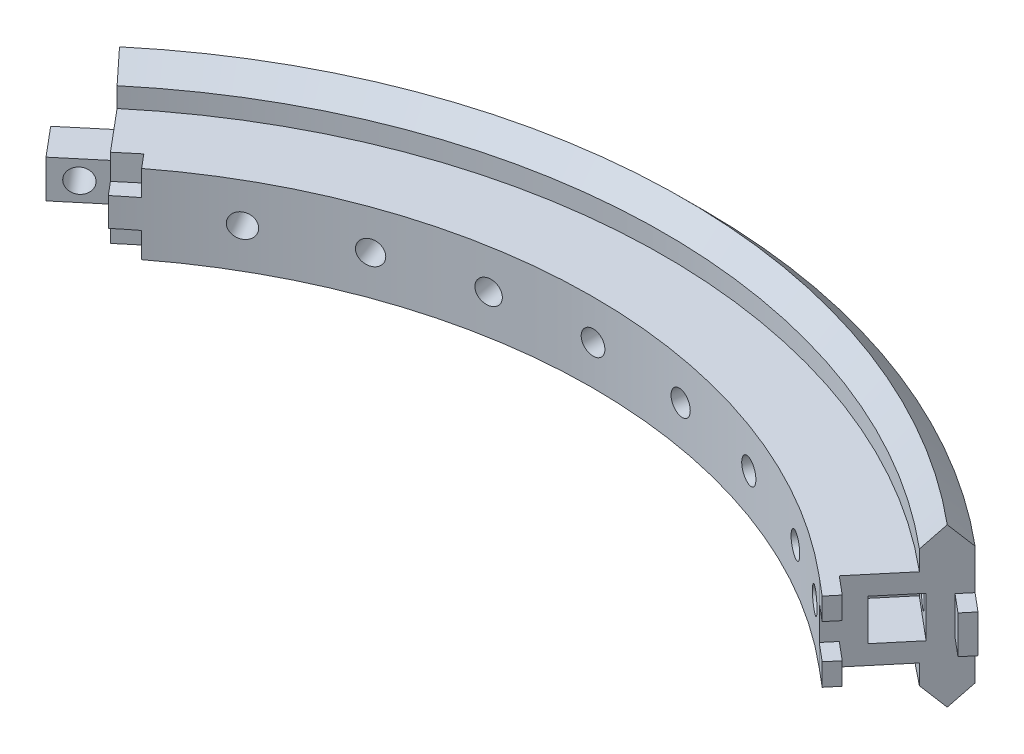
from build123d import *

# Parameters (mm, degrees)
REVOLVE_1_ANGLE          = 80
SKETCH_3_W               = 5.2
SKETCH_3_H               = 5.2
CUT_EXTRUDE_1_DEPTH      = 7
SKETCH_4_W               = 4.8
SKETCH_4_H               = 4.8
EXTRUDE_1_DEPTH          = 6
CUT_EXTRUDE_2_DEPTH      = 108.390367104
CUT_EXTRUDE_2_DEPTH_BACK = 108.390367104
SKETCH_5_R               = 1.5
CUT_EXTRUDE_START        = -1
SKETCH_6_R               = 3
CUT_EXTRUDE_3_DEPTH      = 109.709546841
SKETCH_7_R               = 1.5
CUT_EXTRUDE_4_DEPTH      = 109.021966902
SKETCH_11_R              = 1.5
CUT_EXTRUDE_6_DEPTH      = 65.328766587
CUT_EXTRUDE_7_DEPTH      = 5
PATTERN_CIRCULAR_1_COUNT = 4
PATTERN_CIRCULAR_1_ANGLE = 30
F_1_THE_OTHER_WAY_COUNT  = 4
F_1_THE_OTHER_WAY_ANGLE  = 30
SKETCH_9_W               = 1.8
SKETCH_9_H               = 4.8
SKETCH_9_H_2             = 2.8
EXTRUDE_2_DEPTH          = 3
SKETCH_10_W              = 2.2
SKETCH_10_H              = 5.2
CUT_EXTRUDE_5_DEPTH      = 3


# Read off the part's stored shape, not the designer's step: 旋转1
with BuildPart() as part:
    # 旋转1 outline → 旋转1 (revolve)
    with BuildSketch(Plane(origin=(0, 0, 0), x_dir=(0.6427876096865408, 0, -0.7660444431189768), z_dir=(0.7660444431189768, 0, 0.6427876096865408))):
        Polygon((79, 5), (70, 5), (70, -5), (79, -5), (79, -7.5), (81.5, -10), (84, -7.5), (84, 7.5), (81.5, 10), (79, 7.5), align=None)
    revolve(axis=Axis((0, 0, 0), (0, 1, 0)), revolution_arc=REVOLVE_1_ANGLE)

    # 草图3 → 切除-拉伸1 (cut)
    with BuildSketch(Plane(origin=(0, 0, 0), x_dir=(0.6427876096865405, 0, -0.766044443118977), z_dir=(0.7660444431189771, 0, 0.6427876096865406))):
        with Locations((77, 0)):
            Rectangle(SKETCH_3_W, SKETCH_3_H)
    extrude(amount=-CUT_EXTRUDE_1_DEPTH, mode=Mode.SUBTRACT)

    # 草图4 → 凸台-拉伸1 (add)
    with BuildSketch(Plane(origin=(0, 0, 0), x_dir=(0.6427876096865351, 0, 0.7660444431189817), z_dir=(-0.7660444431189817, 0, 0.6427876096865351))):
        with Locations((-77, 0)):
            Rectangle(SKETCH_4_W, SKETCH_4_H)
    extrude(amount=EXTRUDE_1_DEPTH)

    # 草图5 → 切除-拉伸2 (cut, two sides: drawn at the far end of the back side and taken through both)
    with BuildSketch(Plane(origin=(47.823398161, 0, -56.993706568), x_dir=(-0.7660444431189772, 0, -0.6427876096865404), z_dir=(0.6427876096865404, 0, -0.7660444431189772)).offset(-CUT_EXTRUDE_2_DEPTH_BACK)):
        with Locations((3.5, 0)):
            Circle(SKETCH_5_R)
    extrude(amount=CUT_EXTRUDE_2_DEPTH + CUT_EXTRUDE_2_DEPTH_BACK, mode=Mode.SUBTRACT)

    # 草图6 → 切除-拉伸3 (cut, through all)
    with BuildSketch(Plane(origin=(51.165893731, 0, -60.977137672), x_dir=(0.7660444431189772, 0, 0.6427876096865404), z_dir=(-0.6427876096865404, 0, 0.7660444431189772)).offset(CUT_EXTRUDE_START)):
        with Locations((-3.5, 0)):
            Circle(SKETCH_6_R)
    extrude(amount=-CUT_EXTRUDE_3_DEPTH, mode=Mode.SUBTRACT)

    # 草图7 → 切除-拉伸4 (cut, through all)
    with BuildSketch(Plane(origin=(-51.037336209, 0, -60.823928784), x_dir=(-0.7660444431189816, 0, 0.6427876096865353), z_dir=(-0.6427876096865353, 0, -0.7660444431189816))):
        with Locations((3, 0)):
            Circle(SKETCH_7_R)
    extrude(amount=-CUT_EXTRUDE_4_DEPTH, mode=Mode.SUBTRACT)

    # 草图11 → 切除-拉伸6 (cut, through all)
    with BuildSketch(Plane(origin=(0, 0, -84), x_dir=(-1, 0, 0), z_dir=(0, 0, -1))):
        Circle(SKETCH_11_R)
    cut_extrude_6 = extrude(amount=-CUT_EXTRUDE_6_DEPTH, mode=Mode.SUBTRACT)

    # 草图12 → 切除-拉伸7 (cut)
    with BuildSketch(Plane(origin=(0, 0, -84), x_dir=(-1, 0, 0), z_dir=(0, 0, -1))):
        Polygon((0, -3.175426481), (2.75, -1.58771324), (2.75, 1.58771324), (0, 3.175426481), (-2.75, 1.58771324), (-2.75, -1.58771324), align=None)
    cut_extrude_7 = extrude(amount=-CUT_EXTRUDE_7_DEPTH, mode=Mode.SUBTRACT)

    # 阵列(圆周)1: 切除-拉伸6, 切除-拉伸7 ×4 about axis
    pattern_circular_1_axis = Axis((0, 0, 0), (0, -1, 0))
    add([cut_extrude_6.rotate(pattern_circular_1_axis, i * PATTERN_CIRCULAR_1_ANGLE / (PATTERN_CIRCULAR_1_COUNT - 1)) for i in range(1, PATTERN_CIRCULAR_1_COUNT)], mode=Mode.SUBTRACT)
    add([cut_extrude_7.rotate(pattern_circular_1_axis, i * PATTERN_CIRCULAR_1_ANGLE / (PATTERN_CIRCULAR_1_COUNT - 1)) for i in range(1, PATTERN_CIRCULAR_1_COUNT)], mode=Mode.SUBTRACT)

    # 1 the other way: 切除-拉伸6, 切除-拉伸7 ×4 about axis
    f_1_the_other_way_axis = Axis((0, 0, 0), (0, 1, 0))
    add([cut_extrude_6.rotate(f_1_the_other_way_axis, i * F_1_THE_OTHER_WAY_ANGLE / (F_1_THE_OTHER_WAY_COUNT - 1)) for i in range(1, F_1_THE_OTHER_WAY_COUNT)], mode=Mode.SUBTRACT)
    add([cut_extrude_7.rotate(f_1_the_other_way_axis, i * F_1_THE_OTHER_WAY_ANGLE / (F_1_THE_OTHER_WAY_COUNT - 1)) for i in range(1, F_1_THE_OTHER_WAY_COUNT)], mode=Mode.SUBTRACT)

    # 草图9 → 凸台-拉伸2 (add)
    with BuildSketch(Plane(origin=(0, 0, 0), x_dir=(0.6427876096865405, 0, -0.7660444431189771), z_dir=(0.7660444431189771, 0, 0.6427876096865405))):
        with Locations((83.1, 0)):
            Rectangle(SKETCH_9_W, SKETCH_9_H)
        with Locations((70.9, 3.6)):
            Rectangle(SKETCH_9_W, SKETCH_9_H_2)
        with Locations((70.9, -3.6)):
            Rectangle(SKETCH_9_W, SKETCH_9_H_2)
    extrude(amount=EXTRUDE_2_DEPTH)

    # 草图10 → 切除-拉伸5 (cut)
    with BuildSketch(Plane(origin=(0, 0, 0), x_dir=(0.6427876096865351, 0, 0.7660444431189817), z_dir=(-0.7660444431189817, 0, 0.6427876096865351))):
        with Locations((-82.9, 0)):
            Rectangle(SKETCH_10_W, SKETCH_10_H)
        Polygon((-72.2, 5), (-70, 5), (-68, 5), (-68, 1.8), (-70, 1.8), (-72.2, 1.8), align=None)
        Polygon((-72.2, -1.8), (-70, -1.8), (-68, -1.8), (-68, -5), (-70, -5), (-72.2, -5), align=None)
    extrude(amount=-CUT_EXTRUDE_5_DEPTH, mode=Mode.SUBTRACT)


solid = part.part
